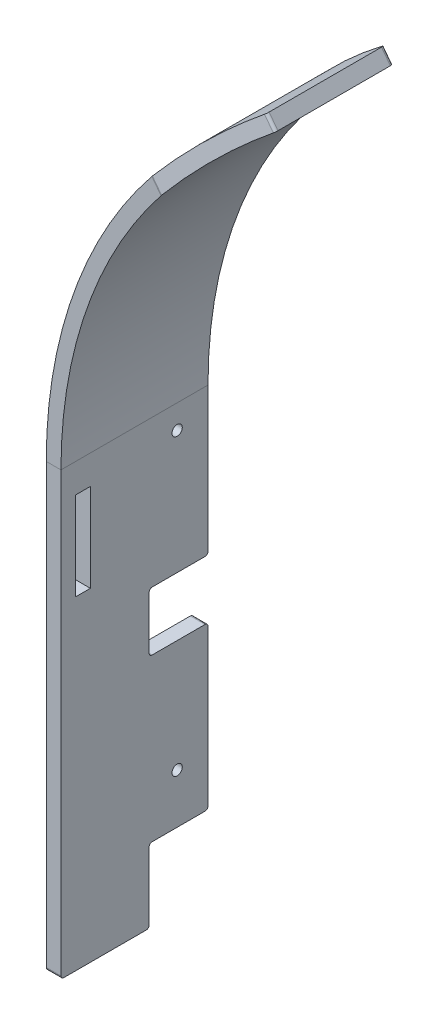
from build123d import *

# Parameters (mm, degrees)
BASE_FLANGE2_DEPTH = 50
SKETCH14_R         = 1.7500000000000004
CUT_EXTRUDE1_DEPTH = 10
CUT_EXTRUDE2_DEPTH = 10
CHAMFER1_SIZE      = 40
CHAMFER1_SIZE2     = 10
FILLET1_R          = 1
CUT_EXTRUDE3_DEPTH = 10


# Sheet-metal steps are written as plain solids
with BuildPart() as part:
    # Sketch13 → Base-Flange2 (new body)
    with BuildSketch(Plane.XY):
        with BuildLine():
            Line((0, 0), (0, 150))
            ThreePointArc((0, 150), (17.155581462513624, 222.67220926874307), (64.99999999999997, 279.99999999999994))
            Line((64.99999999999997, 279.99999999999994), (67.99999999999997, 275.99999999999994))
            ThreePointArc((67.99999999999997, 275.99999999999994), (21.627717417513225, 220.4361412912433), (5, 150))
            Line((5, 150), (5, 0))
            Line((5, 0), (0, 0))
        make_face()
    extrude(amount=BASE_FLANGE2_DEPTH)

    # Sketch14 → Cut-Extrude1 (cut)
    with BuildSketch(Plane(origin=(5, 0, 0), x_dir=(0, 0, -1), z_dir=(1, 0, 0))):
        with Locations((-10.500030729924669, 141.8914274868206)):
            Circle(SKETCH14_R)
        with Locations((-10.500008780040803, 41.896427486823015)):
            Circle(SKETCH14_R)
    extrude(amount=-CUT_EXTRUDE1_DEPTH, mode=Mode.SUBTRACT)

    # Sketch15 → Cut-Extrude2 (cut)
    with BuildSketch(Plane.ZY):
        Polygon((0, 0), (20.000000000000004, 0), (19.999999999999996, 25), (0, 25), align=None)
        Polygon((6.94e-15, 80), (20.000000000000007, 80), (20.000000000000004, 100), (0, 100), align=None)
    extrude(amount=-CUT_EXTRUDE2_DEPTH, mode=Mode.SUBTRACT)

    # Chamfer1
    chamfer1_edges = [part.edges().sort_by_distance(p)[0] for p in [
        (66.49999999999997, 277.99999999999994, 50),
    ]]
    chamfer1_side = [part.faces().sort_by_distance(p)[0] for p in [
        (2.88138855415232, 75, 50),
    ]]
    chamfer(chamfer1_edges, length=CHAMFER1_SIZE, length2=CHAMFER1_SIZE2, reference=chamfer1_side[0])

    # Fillet1
    fillet1_edges = [part.edges().sort_by_distance(p)[0] for p in [
        (2.5, 0, 50),
        (2.5, 80, 6.94e-15),
        (2.5, 100, 0),
        (2.5, 25, 0),
        (2.5, 25, 19.999999999999996),
        (2.5, 0, 20.000000000000004),
        (2.5, 100, 20.000000000000004),
        (2.5, 80, 20.000000000000007),
        (66.49999999999997, 277.99999999999994, 0),
        (66.49999999999996, 277.99999999999994, 40),
        (37.54920679025358, 249.93439094632848, 50),
    ]]
    fillet(fillet1_edges, radius=FILLET1_R)

    # Sketch16 → Cut-Extrude3 (cut)
    with BuildSketch(Plane(origin=(5, 0, 0), x_dir=(0, 0, -1), z_dir=(1, 0, 0))):
        Polygon((-40, 140.1414274868206), (-40.00000000000002, 110.1414274868206), (-45.000000000000014, 110.1414274868206), (-45, 140.1414274868206), align=None)
    extrude(amount=-CUT_EXTRUDE3_DEPTH, mode=Mode.SUBTRACT)


solid = part.part
